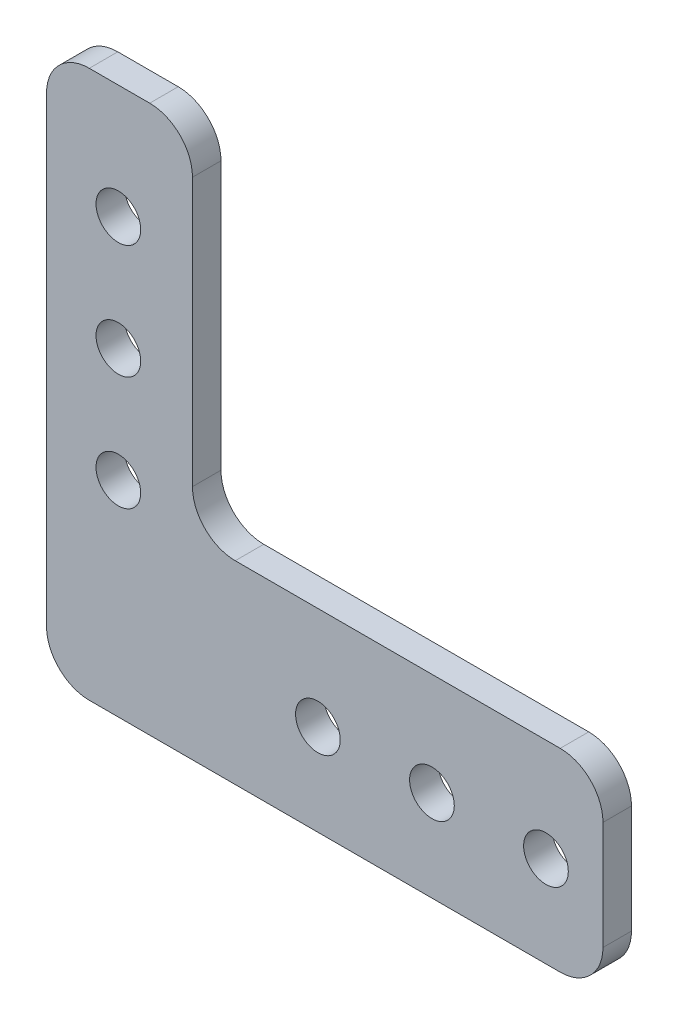
from build123d import *

# Parameters (mm, degrees)
SKETCH1_R           = 2.4892
BOSS_EXTRUDE1_DEPTH = 3.175
FILLET1_R           = 4.7625


with BuildPart() as part:
    # Sketch1 → Boss-Extrude1 (new body)
    with BuildSketch(Plane.XY):
        Polygon((-27.051, 31.75), (-27.051, -29.21), (34.925, -29.21), (34.925, -7.62), (-10.795, -7.62), (-10.795, 31.75), align=None)
        with Locations((-19.05, -6.35)):
            Circle(SKETCH1_R, mode=Mode.SUBTRACT)
        with Locations((3.175, -19.05)):
            Circle(SKETCH1_R, mode=Mode.SUBTRACT)
        with Locations((15.875, -19.05)):
            Circle(SKETCH1_R, mode=Mode.SUBTRACT)
        with Locations((28.575, -19.05)):
            Circle(SKETCH1_R, mode=Mode.SUBTRACT)
        with Locations((-19.05, 6.35)):
            Circle(SKETCH1_R, mode=Mode.SUBTRACT)
        with Locations((-19.05, 19.05)):
            Circle(SKETCH1_R, mode=Mode.SUBTRACT)
    extrude(amount=BOSS_EXTRUDE1_DEPTH)

    # Fillet1
    fillet1_edges = [part.edges().sort_by_distance(p)[0] for p in [
        (-27.051, 31.75, 1.5875),
        (-10.795, 31.75, 1.5875),
        (-10.795, -7.62, 1.5875),
        (34.925, -7.62, 1.5875),
        (34.925, -29.21, 1.5875),
        (-27.051, -29.21, 1.5875),
    ]]
    fillet(fillet1_edges, radius=FILLET1_R)


solid = part.part
